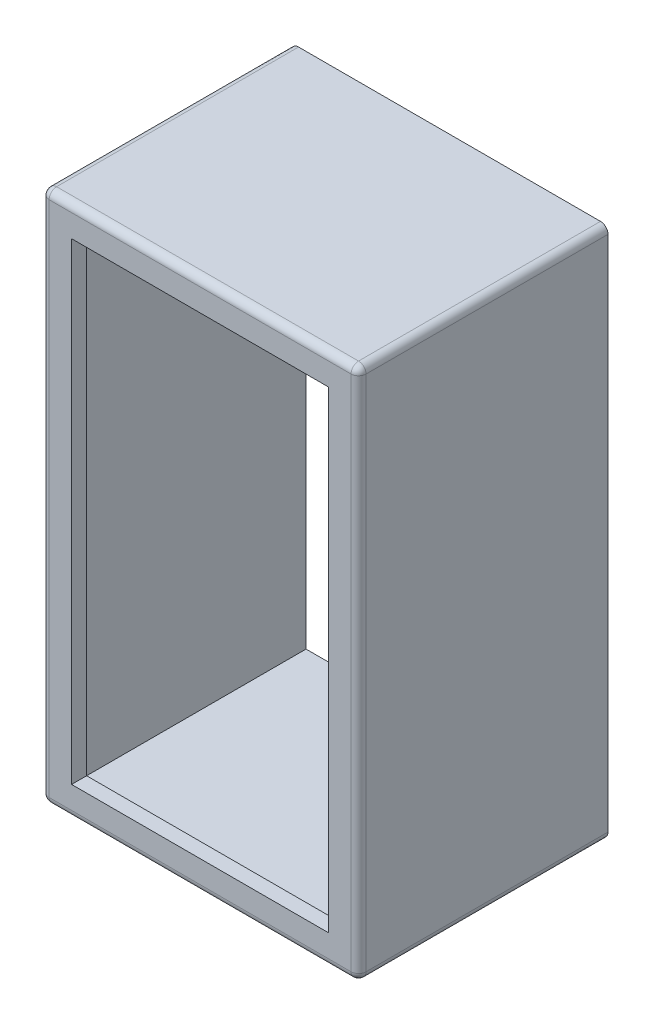
from build123d import *

# Parameters (mm, degrees)
SKETCH1_W           = 10.7315
SKETCH1_H           = 18.034
BOSS_EXTRUDE1_DEPTH = 7.9375
SHELL1_T            = -0.508
SKETCH2_W           = 10.7315
SKETCH2_H           = 18.034
SKETCH2_W_2         = 8.6995
SKETCH2_H_2         = 16.002
EXTRUDE_THIN1_DEPTH = 0.508
FILLET2_R           = 0.254


with BuildPart() as part:
    # Sketch1 → Boss-Extrude1 (new body)
    with BuildSketch(Plane.XY):
        with Locations((14.669644351, 41.878696913)):
            Rectangle(SKETCH1_W, SKETCH1_H)
    extrude(amount=BOSS_EXTRUDE1_DEPTH)

    # Shell1
    shell1_openings = [part.faces().sort_by_distance(p)[0] for p in [
        (14.669644351, 41.878696913, 0),
        (14.669644351, 41.878696913, 7.9375),
    ]]
    offset(amount=SHELL1_T, openings=shell1_openings, kind=Kind.INTERSECTION)

    # Sketch2 → Extrude-Thin1 (add)
    with BuildSketch(Plane.XY.offset(7.9375)):
        with Locations((14.669644351, 41.878696913)):
            Rectangle(SKETCH2_W, SKETCH2_H)
        with Locations((14.669644351, 41.878696913)):
            Rectangle(SKETCH2_W_2, SKETCH2_H_2, mode=Mode.SUBTRACT)
    extrude(amount=EXTRUDE_THIN1_DEPTH)

    # Fillet2
    fillet2_edges = [part.edges().sort_by_distance(p)[0] for p in [
        (9.303894351, 50.895696913, 4.22275),
        (20.035394351, 50.895696913, 4.22275),
        (20.035394351, 32.861696913, 4.22275),
        (9.303894351, 32.861696913, 4.22275),
        (14.669644351, 50.895696913, 8.4455),
        (20.035394351, 41.878696913, 8.4455),
        (14.669644351, 32.861696913, 8.4455),
        (9.303894351, 41.878696913, 8.4455),
    ]]
    fillet(fillet2_edges, radius=FILLET2_R)


solid = part.part
